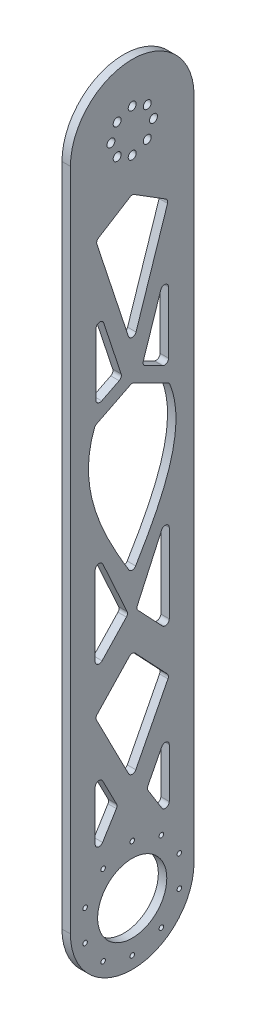
from build123d import *

# Parameters (mm, degrees)
SKETCH1_R           = 3
SKETCH1_R_2         = 1.7
SKETCH1_R_3         = 26
BOSS_EXTRUDE1_DEPTH = 6.35
CUT_EXTRUDE1_DEPTH  = 549.511460682
FILLET1_R           = 3


with BuildPart() as part:
    # Sketch1 → Boss-Extrude1 (new body)
    with BuildSketch(Plane(origin=(0, 0, 0), x_dir=(0, -1, 0), z_dir=(1, 0, 0))):
        with BuildLine():
            Line((500, 46.5), (0, 46.5))
            ThreePointArc((0, 46.5), (-46.5, 0), (0, -46.5))
            Line((0, -46.5), (500, -46.5))
            ThreePointArc((500, -46.5), (546.5, 0), (500, 46.5))
        make_face()
        with Locations((0, -16)):
            Circle(SKETCH1_R, mode=Mode.SUBTRACT)
        with Locations((-11.313708499, -11.313708499)):
            Circle(SKETCH1_R, mode=Mode.SUBTRACT)
        with Locations((11.313708499, -11.313708499)):
            Circle(SKETCH1_R, mode=Mode.SUBTRACT)
        with Locations((16, 0)):
            Circle(SKETCH1_R, mode=Mode.SUBTRACT)
        with Locations((488.48911696, -35.426855232)):
            Circle(SKETCH1_R_2, mode=Mode.SUBTRACT)
        with Locations((511.51088304, -35.426855232)):
            Circle(SKETCH1_R_2, mode=Mode.SUBTRACT)
        with Locations((469.86411696, -21.895000648)):
            Circle(SKETCH1_R_2, mode=Mode.SUBTRACT)
        with Locations((530.13588304, -21.895000648)):
            Circle(SKETCH1_R_2, mode=Mode.SUBTRACT)
        with Locations((462.75, 0)):
            Circle(SKETCH1_R_2, mode=Mode.SUBTRACT)
        with Locations((-16, 0)):
            Circle(SKETCH1_R, mode=Mode.SUBTRACT)
        with Locations((-11.313708499, 11.313708499)):
            Circle(SKETCH1_R, mode=Mode.SUBTRACT)
        with Locations((11.313708499, 11.313708499)):
            Circle(SKETCH1_R, mode=Mode.SUBTRACT)
        with Locations((0, 16)):
            Circle(SKETCH1_R, mode=Mode.SUBTRACT)
        with Locations((500, 0)):
            Circle(SKETCH1_R_3, mode=Mode.SUBTRACT)
        with Locations((537.25, 0)):
            Circle(SKETCH1_R_2, mode=Mode.SUBTRACT)
        with Locations((469.86411696, 21.895000648)):
            Circle(SKETCH1_R_2, mode=Mode.SUBTRACT)
        with Locations((530.13588304, 21.895000648)):
            Circle(SKETCH1_R_2, mode=Mode.SUBTRACT)
        with Locations((488.48911696, 35.426855232)):
            Circle(SKETCH1_R_2, mode=Mode.SUBTRACT)
        with Locations((511.51088304, 35.426855232)):
            Circle(SKETCH1_R_2, mode=Mode.SUBTRACT)
    extrude(amount=BOSS_EXTRUDE1_DEPTH)

    # Sketch3 → Cut-Extrude1 (cut, through all)
    with BuildSketch(Plane(origin=(6.35, 0, 0), x_dir=(0, 0, -1), z_dir=(1, 0, 0))):
        Polygon((0, -422.848022722), (27.858212922, -368.632839363), (0, -339.139268075), (-27.858212922, -368.632839363), align=None)
        Polygon((0, -41.368651369), (-27.312924288, -58.435222232), (0, -141.248998295), (27.312924288, -58.435222232), align=None)
        Polygon((3, -313.189087212), (27.858212922, -339.506549748), (27.858212922, -258.646044282), align=None)
        Polygon((-27.858212922, -339.506549748), (-27.858212922, -258.646044282), (-3, -313.189087212), align=None)
        Polygon((-27.858212922, -401.452857349), (-11, -434.260816252), (-27.858212922, -461.481824785), align=None)
        Polygon((11, -434.260816252), (27.858212922, -461.481824785), (27.858212922, -401.452857349), align=None)
        with BuildLine():
            Line((0, -164.248853344), (-27.858212922, -178.200474573))
            add(Edge.make_bspline(
                [(-27.858212922, -178.200474573), (-43.7790539, -216.093343216), (-18.61661693, -258.276071598), (0, -289.085024731)],
                knots=[0, 0, 0, 0, 1, 1, 1, 1], degree=3))
            add(Edge.make_bspline(
                [(27.858212922, -178.200474573), (43.7790539, -216.093343216), (18.61661693, -258.276071598), (0, -289.085024731)],
                knots=[0, 0, 0, 0, 1, 1, 1, 1], degree=3))
            Line((27.858212922, -178.200474573), (0, -164.248853344))
        make_face()
        Polygon((7.5, -156.820958214), (27.312924288, -96.747453897), (27.312924288, -166.743432993), align=None)
        Polygon((-27.312924288, -96.747453897), (-27.312924288, -166.743432993), (-7.5, -156.820958214), align=None)
    extrude(amount=-CUT_EXTRUDE1_DEPTH, mode=Mode.SUBTRACT)

    # Fillet1
    fillet1_edges = [part.edges().sort_by_distance(p)[0] for p in [
        (3.175, -58.435222232, -27.312924288),
        (3.175, -41.368651369, 0),
        (3.175, -58.435222232, 27.312924288),
        (3.175, -141.248998295, 0),
        (3.175, -289.085024731, 0),
        (3.175, -164.248853344, 0),
        (3.175, -401.452857349, 27.858212922),
        (3.175, -434.260816252, 11),
        (3.175, -461.481824785, 27.858212922),
        (3.175, -461.481824785, -27.858212922),
        (3.175, -434.260816252, -11),
        (3.175, -401.452857349, -27.858212922),
        (3.175, -368.632839363, -27.858212922),
        (3.175, -339.139268075, 0),
        (3.175, -368.632839363, 27.858212922),
        (3.175, -422.848022722, 0),
        (3.175, -313.189087212, 3),
        (3.175, -339.506549748, 27.858212922),
        (3.175, -258.646044282, 27.858212922),
        (3.175, -178.200474573, -27.858212922),
        (3.175, -178.200474573, 27.858212922),
        (3.175, -339.506549748, -27.858212922),
        (3.175, -313.189087212, -3),
        (3.175, -258.646044282, -27.858212922),
        (3.175, -96.747453897, 27.312924288),
        (3.175, -166.743432993, 27.312924288),
        (3.175, -156.820958214, 7.5),
        (3.175, -166.743432993, -27.312924288),
        (3.175, -156.820958214, -7.5),
        (3.175, -96.747453897, -27.312924288),
    ]]
    fillet(fillet1_edges, radius=FILLET1_R)


solid = part.part
